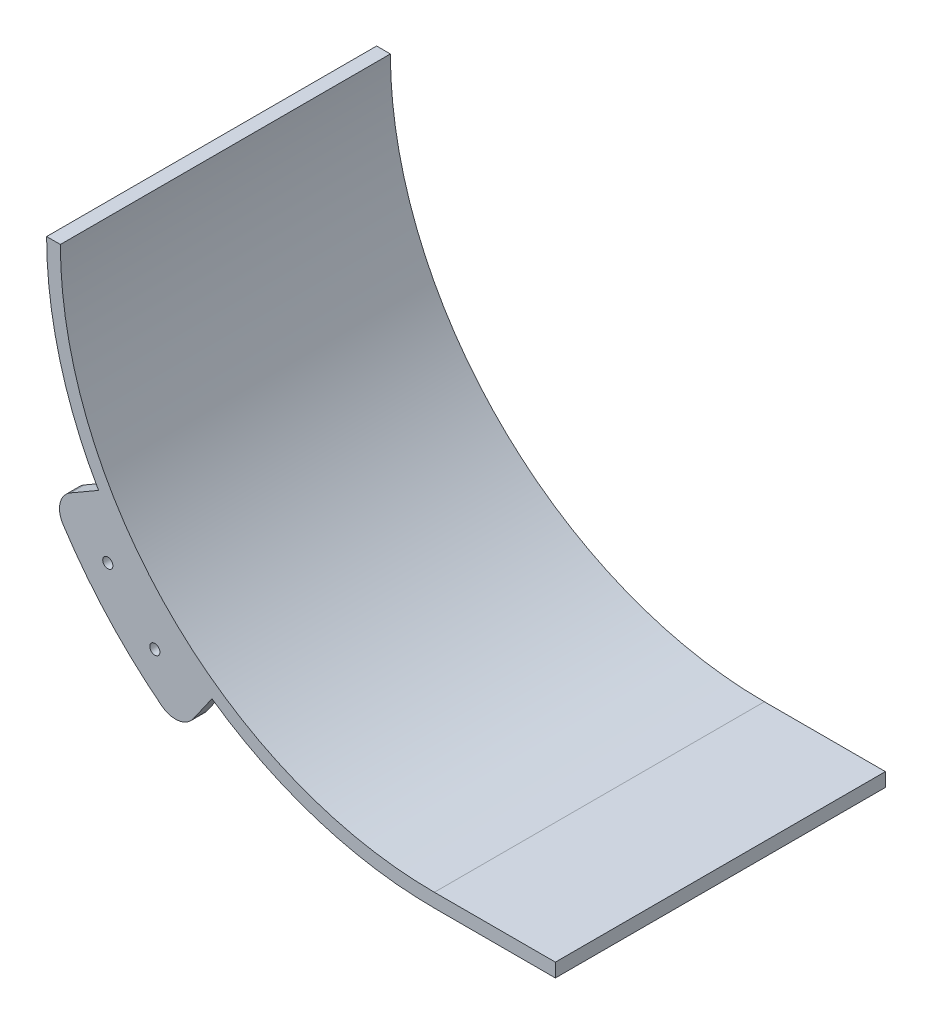
from build123d import *

# Parameters (mm, degrees)
BOSS_EXTRUDE1_DEPTH = 76.2
BOSS_EXTRUDE2_DEPTH = 6.35
SKETCH3_R           = 2.3495
CUT_EXTRUDE2_DEPTH  = 296.563681463


with BuildPart() as part:
    # Sketch1 → Boss-Extrude1 (new, symmetric)
    with BuildSketch(Plane.XY):
        with BuildLine():
            Line((-179.07, 0), (-172.72, 0))
            ThreePointArc((-172.72, 0), (-122.131483247, -122.131483247), (0, -172.72))
            Line((0, -172.72), (55.88, -172.72))
            Line((55.88, -172.72), (55.88, -179.07))
            Line((55.88, -179.07), (0, -179.07))
            ThreePointArc((0, -179.07), (-126.621611307, -126.621611307), (-179.07, 0))
        make_face()
    extrude(amount=BOSS_EXTRUDE1_DEPTH, both=True)

    # Sketch2 → Boss-Extrude2 (add)
    with BuildSketch(Plane.XY.offset(76.2)):
        with BuildLine():
            Line((-155.079169056, -89.535), (-168.047204306, -97.022098643))
            ThreePointArc((-168.047204306, -97.022098643), (-172.846425248, -103.448872568), (-171.488365315, -111.354036575))
            ThreePointArc((-171.488365315, -111.354036575), (-150.751097058, -138.137929751), (-125.876496699, -161.130656546))
            ThreePointArc((-125.876496699, -161.130656546), (-118.11977695, -163.172529091), (-111.299179173, -158.951700888))
            Line((-111.299179173, -158.951700888), (-102.710332457, -146.685556571))
            ThreePointArc((-102.710332457, -146.685556571), (-132.024252703, -120.977938478), (-155.079169056, -89.535))
        make_face()
    boss_extrude2 = extrude(amount=-BOSS_EXTRUDE2_DEPTH)

    # Mirror1: Boss-Extrude2 across plane
    add(boss_extrude2.mirror(Plane.XY))

    # Sketch3 → Cut-Extrude2 (cut, through all)
    with BuildSketch(Plane.XY.offset(76.2)):
        with Locations((-150.804793508, -116.396581802)):
            Circle(SKETCH3_R)
        with Locations((-129.097161455, -140.086305199)):
            Circle(SKETCH3_R)
    extrude(amount=-CUT_EXTRUDE2_DEPTH, mode=Mode.SUBTRACT)


solid = part.part
